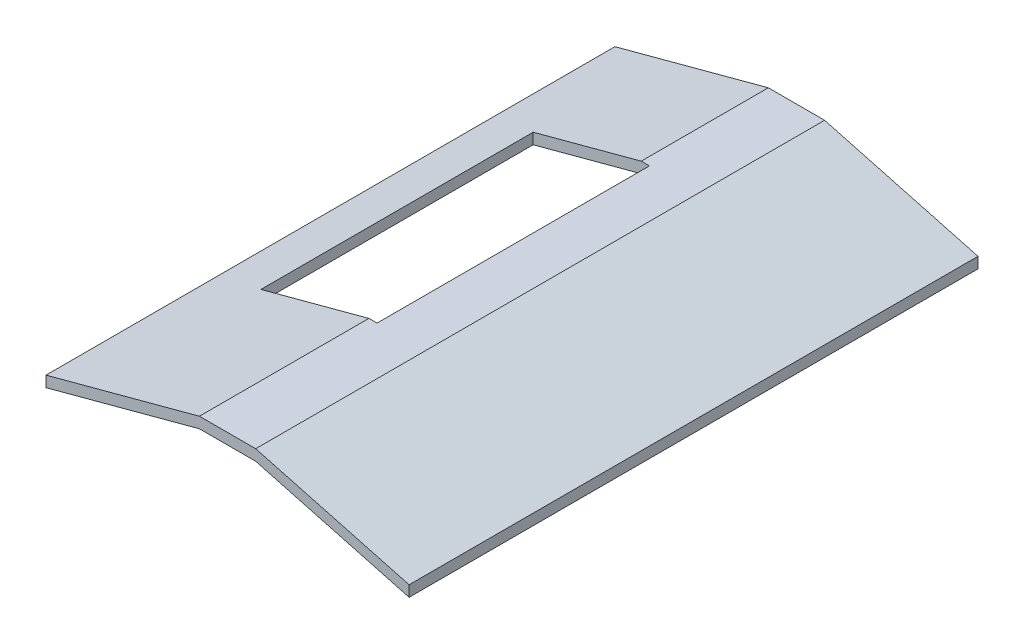
from build123d import *

# Parameters (mm, degrees)
AUFSATZ_LINEAR_AUSTRAGEN1_DEPTH = 1566.7
SCHNITT_LINEAR_AUSTRAGEN1_REACH = 1704.359
SKIZZE2_W                       = 320
SKIZZE2_H                       = 750


with BuildPart() as part:
    # Skizze1 → Aufsatz-Linear austragen1 (new body)
    with BuildSketch(Plane.XY):
        Polygon((650.360476489, 174.221083784), (650.360476489, 144.221083784), (227.860476489, 257.429617586), (72.860476489, 257.429617586), (-349.639523511, 144.221083784), (-349.639523511, 174.221083784), (72.860476489, 287.429617586), (227.860476489, 287.429617586), align=None)
    extrude(amount=AUFSATZ_LINEAR_AUSTRAGEN1_DEPTH)

    # Skizze2 → Schnitt-Linear austragen1 (cut, up to next)
    with BuildSketch(Plane(origin=(0, 287.429617586, 0), x_dir=(1, 0, 0), z_dir=(0, 1, 0)), mode=Mode.PRIVATE) as schnitt_linear_austragen1_sk1:
        with Locations((-64.639523511, -725)):
            Rectangle(SKIZZE2_W, SKIZZE2_H)
    schnitt_linear_austragen1_tool1 = extrude(schnitt_linear_austragen1_sk1.sketch, amount=-SCHNITT_LINEAR_AUSTRAGEN1_REACH, mode=Mode.PRIVATE) & part.part
    add(schnitt_linear_austragen1_tool1.solids().sort_by_distance((-64.639524, 287.429618, 725))[0], mode=Mode.SUBTRACT)


solid = part.part
